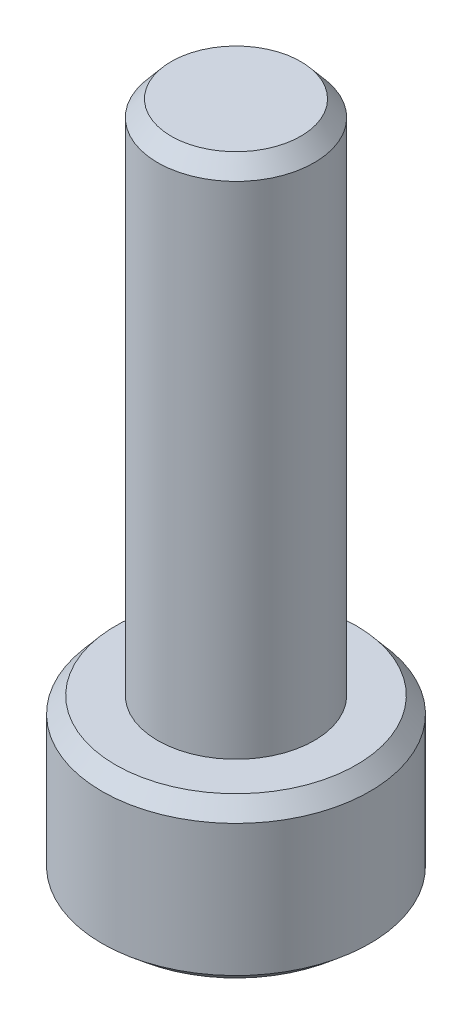
from build123d import *
from OCP.BRepFilletAPI import BRepFilletAPI_MakeChamfer

# Parameters (mm, degrees)
SKETCH1_R           = 4.15
BOSS_EXTRUDE1_DEPTH = 5
SKETCH2_R           = 2.425
BOSS_EXTRUDE2_DEPTH = 16
CUT_EXTRUDE1_DEPTH  = 3
CHAMFER1_SIZE       = 0.5
CHAMFER1_SIZE2      = 0.419549816


with BuildPart() as part:
    # Sketch1 → Boss-Extrude1 (new body)
    with BuildSketch(Plane(origin=(0, 0, 0), x_dir=(1, 0, 0), z_dir=(0, 1, 0))):
        Circle(SKETCH1_R)
    extrude(amount=BOSS_EXTRUDE1_DEPTH)

    # Sketch2 → Boss-Extrude2 (add)
    with BuildSketch(Plane(origin=(0, 5, 0), x_dir=(1, 0, 0), z_dir=(0, 1, 0))):
        Circle(SKETCH2_R)
    extrude(amount=BOSS_EXTRUDE2_DEPTH)

    # Sketch3 → Cut-Extrude1 (cut)
    with BuildSketch(Plane.XZ):
        Polygon((0, 2.786041865), (-2.412783031, 1.393020932), (-2.412783031, -1.393020932), (0, -2.786041865), (2.412783031, -1.393020932), (2.412783031, 1.393020932), align=None)
    extrude(amount=-CUT_EXTRUDE1_DEPTH, mode=Mode.SUBTRACT)

    # Chamfer1: one chamfer whose edges measure the first distance from different faces: ONE call of the kernel's chamfer builder (chamfer() names one face for all edges)
    chamfer1_edges_1 = [part.edges().sort_by_distance(p)[0] for p in [
        (-4.15, 0, 0),
    ]]
    chamfer1_side_1 = [part.faces().sort_by_distance(p)[0] for p in [
        (-4.032620274, 0, 0),
    ]]
    chamfer1_edges_2 = [part.edges().sort_by_distance(p)[0] for p in [
        (-4.15, 5, 0),
    ]]
    chamfer1_side_2 = [part.faces().sort_by_distance(p)[0] for p in [
        (-4.15, 2.5, 0),
    ]]
    chamfer1_edges_3 = [part.edges().sort_by_distance(p)[0] for p in [
        (-2.425, 21, 0),
    ]]
    chamfer1_side_3 = [part.faces().sort_by_distance(p)[0] for p in [
        (-2.425, 13, 0),
    ]]
    chamfer1 = BRepFilletAPI_MakeChamfer(part.part.solid().wrapped)
    for e in chamfer1_edges_1:
        chamfer1.Add(CHAMFER1_SIZE, CHAMFER1_SIZE2, e.wrapped, chamfer1_side_1[0].wrapped)  # the first distance lies on this face
    for e in chamfer1_edges_2:
        chamfer1.Add(CHAMFER1_SIZE, CHAMFER1_SIZE2, e.wrapped, chamfer1_side_2[0].wrapped)  # the first distance lies on this face
    for e in chamfer1_edges_3:
        chamfer1.Add(CHAMFER1_SIZE, CHAMFER1_SIZE2, e.wrapped, chamfer1_side_3[0].wrapped)  # the first distance lies on this face
    add(Compound.cast(chamfer1.Shape()), mode=Mode.REPLACE)


solid = part.part
